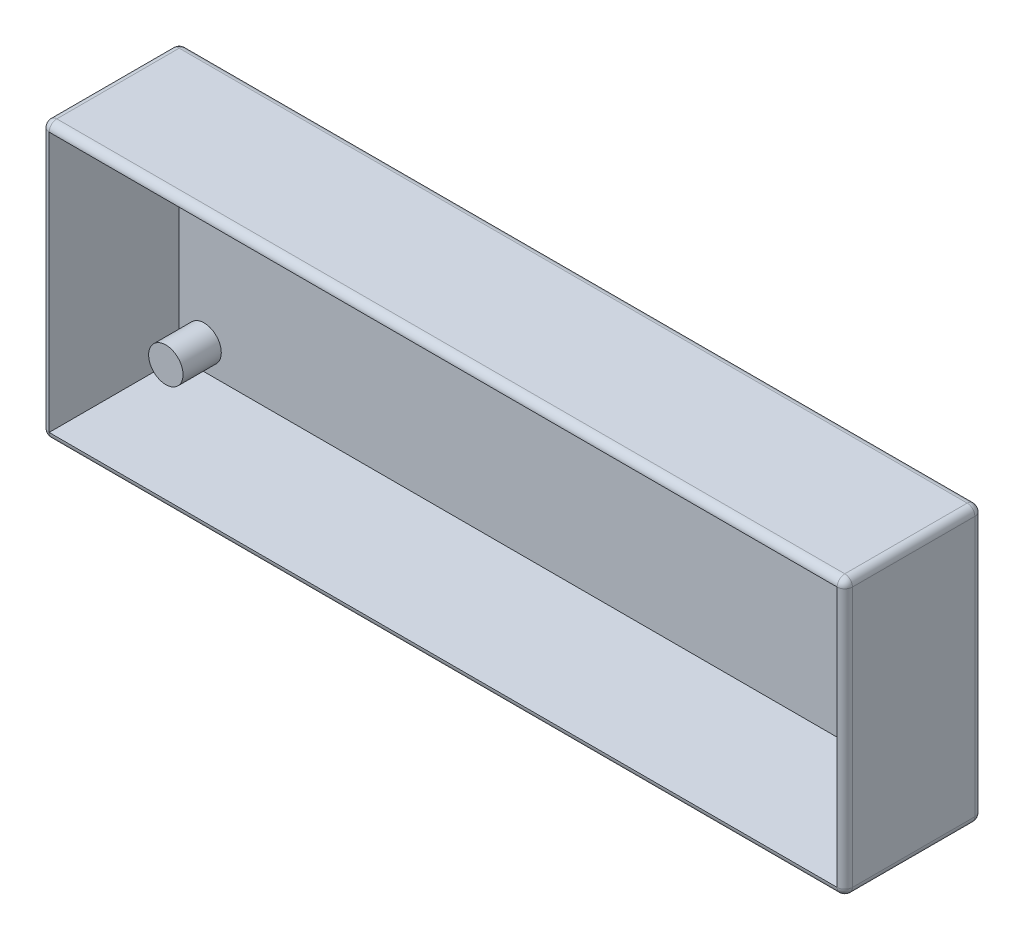
from build123d import *

# Parameters (mm, degrees)
SKETCH2_W           = 105
SKETCH2_H           = 36
BOSS_EXTRUDE1_DEPTH = 9
SHELL1_T            = -1
SKETCH3_R           = 2.25
BOSS_EXTRUDE2_DEPTH = 5
FILLET1_R           = 1
SKETCH5_W           = 0.569871795
SKETCH5_H           = 2.320192308
CUT_EXTRUDE3_DEPTH  = 0.5


with BuildPart() as part:
    # Sketch2 → Boss-Extrude1 (new, symmetric)
    with BuildSketch(Plane.XY):
        Rectangle(SKETCH2_W, SKETCH2_H)
    extrude(amount=BOSS_EXTRUDE1_DEPTH, both=True)

    # Shell1
    shell1_openings = [part.faces().sort_by_distance(p)[0] for p in [
        (0, 0, 9),
    ]]
    offset(amount=SHELL1_T, openings=shell1_openings, kind=Kind.INTERSECTION)

    # Sketch3 → Boss-Extrude2 (add)
    with BuildSketch(Plane.XY.offset(-8)):
        with Locations((-48.25, 13.5)):
            Circle(SKETCH3_R)
        with Locations((48.337693675, 13.587693675)):
            Circle(SKETCH3_R)
        with Locations((48.337693675, -13.629698187)):
            Circle(SKETCH3_R)
        with Locations((-48.25, -13.717391863)):
            Circle(SKETCH3_R)
    extrude(amount=BOSS_EXTRUDE2_DEPTH)

    # Fillet1
    fillet1_edges = [part.edges().sort_by_distance(p)[0] for p in [
        (52.5, 0, 9),
        (0, 18, 9),
        (-52.5, 0, 9),
        (0, 18, -9),
        (52.5, 0, -9),
        (0, -18, -9),
        (-52.5, 0, -9),
        (-52.5, 18, 0),
        (52.5, 18, 0),
        (52.5, -18, 0),
        (-52.5, -18, 0),
        (0, -18, 9),
    ]]
    fillet(fillet1_edges, radius=FILLET1_R - 0.0001)  # a hair under: the kernel refuses the full size

    # Sketch5 → Cut-Extrude3 (cut)
    # profile 1 of 14: a face of its own
    with BuildSketch(Plane.XZ.offset(18)):
        with BuildLine():
            Line((-11.723873197, -3.329997997), (-12.155093149, -3.742773438))
            add(Edge.make_bspline(
                [(-12.155093149, -3.742773438), (-12.189233585, -3.708592095), (-12.256222757, -3.641522658), (-12.365775168, -3.554227177), (-12.479238217, -3.480008761), (-12.596985357, -3.418981187), (-12.719180611, -3.371642895), (-12.845582834, -3.3377803), (-12.976397668, -3.317695822), (-13.064953471, -3.314884063), (-13.109755609, -3.313461538)],
                knots=[0, 0, 0, 0, 1.075575784, 2.110457258, 3.113929901, 4.09197124, 5.059417775, 6.02750972, 7.002078037, 8, 8, 8, 8], degree=3))
            add(Edge.make_bspline(
                [(-13.109755609, -3.313461538), (-13.148597693, -3.314458295), (-13.224867528, -3.316415514), (-13.336938707, -3.331278498), (-13.444029583, -3.356106446), (-13.546646098, -3.390501422), (-13.644161742, -3.435260156), (-13.737141541, -3.48969185), (-13.825013294, -3.554212912), (-13.907085075, -3.627600245), (-13.981811696, -3.707724396), (-14.047051983, -3.79348557), (-14.10262269, -3.883285251), (-14.148368717, -3.977582868), (-14.183176468, -4.076233693), (-14.208024647, -4.17916611), (-14.223797062, -4.286080983), (-14.225659313, -4.359019417), (-14.226602564, -4.395963542)],
                knots=[0, 0, 0, 0, 1.075001177, 2.110859044, 3.123021556, 4.114053297, 5.101481495, 6.087880186, 7.091499647, 8.114004866, 9.131394192, 10.11971144, 11.092043119, 12.050101265, 13.015322563, 13.981809771, 14.977764287, 16, 16, 16, 16], degree=3))
            add(Edge.make_bspline(
                [(-14.226602564, -4.395963542), (-14.225722745, -4.434186352), (-14.223989381, -4.509490522), (-14.207338457, -4.620002628), (-14.181684842, -4.726323238), (-14.14413479, -4.827663477), (-14.097922048, -4.925411564), (-14.039316677, -5.017674028), (-13.97097695, -5.105859816), (-13.893024981, -5.188433563), (-13.808233368, -5.264546685), (-13.716401293, -5.330203823), (-13.62032285, -5.386851761), (-13.518447329, -5.431715097), (-13.412542987, -5.467735441), (-13.30153565, -5.493132875), (-13.18567528, -5.508714112), (-13.106624794, -5.51058764), (-13.06650641, -5.511538462)],
                knots=[0, 0, 0, 0, 1.022067601, 2.013613092, 2.983553406, 3.943623673, 4.90013463, 5.87121881, 6.861774014, 7.881098904, 8.905697761, 9.905387765, 10.89678721, 11.884561068, 12.87834324, 13.885584958, 14.926927371, 16, 16, 16, 16], degree=3))
            add(Edge.make_bspline(
                [(-13.06650641, -5.511538462), (-13.040410888, -5.511303006), (-12.98917957, -5.510840755), (-12.914031958, -5.503337116), (-12.842058595, -5.492609792), (-12.772980749, -5.478408089), (-12.70749592, -5.458310131), (-12.644697426, -5.434808043), (-12.584953211, -5.407070894), (-12.528587202, -5.3741417), (-12.474760509, -5.337232098), (-12.42397696, -5.294999665), (-12.375345753, -5.248396586), (-12.329435136, -5.196853539), (-12.28702216, -5.139909668), (-12.246748022, -5.078611393), (-12.209073852, -5.012350366), (-12.186813179, -4.965560185), (-12.175445713, -4.941666667)],
                knots=[0, 0, 0, 0, 1.109579412, 2.178351274, 3.208885622, 4.204702371, 5.174744997, 6.119429583, 7.05542196, 7.97267548, 8.893247984, 9.828544973, 10.778894627, 11.756245826, 12.760884819, 13.796418446, 14.874735809, 16, 16, 16, 16], degree=3))
            Line((-12.175445713, -4.941666667), (-13.086858974, -4.941666667))
            Line((-13.086858974, -4.941666667), (-13.086858974, -4.371794872))
            Line((-13.086858974, -4.371794872), (-11.503811098, -4.371794872))
            Line((-11.503811098, -4.371794872), (-11.499358974, -4.507266627))
            add(Edge.make_bspline(
                [(-11.499358974, -4.507266627), (-11.499931039, -4.542059211), (-11.501074148, -4.611582288), (-11.511520961, -4.715090307), (-11.528825948, -4.817225506), (-11.552483521, -4.917885304), (-11.582132446, -5.017563474), (-11.619944105, -5.115305513), (-11.664221328, -5.211774275), (-11.713830814, -5.306559844), (-11.769577603, -5.397509174), (-11.829597207, -5.483626184), (-11.893034005, -5.564761824), (-11.961267722, -5.63978567), (-12.033235846, -5.709327956), (-12.109080048, -5.773121145), (-12.189068584, -5.831219214), (-12.272777723, -5.884112958), (-12.36068427, -5.930471204), (-12.452304915, -5.970796728), (-12.547501322, -6.005044344), (-12.646519266, -6.033119939), (-12.749163906, -6.054782494), (-12.85543744, -6.069636537), (-12.965398234, -6.079730026), (-13.039982314, -6.080843408), (-13.077954728, -6.081410256)],
                knots=[0, 0, 0, 0, 1.006889344, 2.011981806, 3.007738725, 4.003571281, 5.003404394, 6.015442001, 7.03424805, 8.074616296, 9.110249922, 10.119753985, 11.111721717, 12.089233633, 13.052717867, 14.006597561, 14.955430184, 15.912305663, 16.870361111, 17.829300583, 18.807640451, 19.796414044, 20.806216501, 21.841577364, 22.90109906, 24, 24, 24, 24], degree=3))
            add(Edge.make_bspline(
                [(-13.077954728, -6.081410256), (-13.118468718, -6.080850484), (-13.198779531, -6.079740847), (-13.317529831, -6.069348343), (-13.432835111, -6.052196185), (-13.544724132, -6.028458186), (-13.653456675, -5.998914349), (-13.758845923, -5.961829845), (-13.860676325, -5.917716656), (-13.959252816, -5.867742914), (-14.053315482, -5.811068338), (-14.142653512, -5.748686723), (-14.226779283, -5.680196797), (-14.306554503, -5.606745095), (-14.380115314, -5.526526169), (-14.450203042, -5.442140301), (-14.513422175, -5.350492557), (-14.572490948, -5.254554182), (-14.624968118, -5.154365379), (-14.670860157, -5.051779192), (-14.709996863, -4.947389596), (-14.740857101, -4.840710518), (-14.765912724, -4.732485814), (-14.783840493, -4.622244838), (-14.793965141, -4.510001392), (-14.79563424, -4.434567982), (-14.796474359, -4.396599559)],
                knots=[0, 0, 0, 0, 1.084149091, 2.14910686, 3.187506334, 4.202448172, 5.208724393, 6.201130722, 7.189831603, 8.176984443, 9.156919086, 10.126598231, 11.090766514, 12.05840148, 13.026036446, 14.001772938, 14.991905635, 16.003017641, 17.015720547, 18.016462227, 19.009322657, 19.99686681, 20.986544154, 21.980959929, 22.983742515, 24, 24, 24, 24], degree=3))
            add(Edge.make_bspline(
                [(-14.796474359, -4.396599559), (-14.79534926, -4.344802517), (-14.793127523, -4.242518714), (-14.77255087, -4.091854024), (-14.740474933, -3.94610097), (-14.694442733, -3.805790374), (-14.635372551, -3.670728957), (-14.564101169, -3.540599655), (-14.479080418, -3.415540786), (-14.413268517, -3.338111977), (-14.379882812, -3.298833133)],
                knots=[0, 0, 0, 0, 1.034044851, 2.041932006, 3.031217818, 4.011390712, 4.986069675, 5.97149666, 6.970960976, 8, 8, 8, 8], degree=3))
            add(Edge.make_bspline(
                [(-14.379882812, -3.298833133), (-14.359153954, -3.276109131), (-14.318007483, -3.23100233), (-14.252234923, -3.168325511), (-14.184794353, -3.109406982), (-14.114751709, -3.055496075), (-14.042475194, -3.005412652), (-13.967756782, -2.960095569), (-13.890988429, -2.918101904), (-13.811571435, -2.881576014), (-13.729921559, -2.848827506), (-13.645677185, -2.821117664), (-13.559469289, -2.79657333), (-13.470534494, -2.777901387), (-13.379771256, -2.762352818), (-13.286535307, -2.751931353), (-13.191080719, -2.744293161), (-13.126520036, -2.743826071), (-13.093855168, -2.743589744)],
                knots=[0, 0, 0, 0, 1.020590567, 2.025856924, 3.013483481, 3.991664875, 4.957826714, 5.930500614, 6.890802512, 7.860442893, 8.829981142, 9.809047939, 10.802672283, 11.803273349, 12.823572789, 13.857849586, 14.916166035, 16, 16, 16, 16], degree=3))
            add(Edge.make_bspline(
                [(-13.093855168, -2.743589744), (-13.059709776, -2.744116324), (-12.991772984, -2.745164026), (-12.890762224, -2.752413442), (-12.791155076, -2.763597581), (-12.693371295, -2.780374429), (-12.597082717, -2.801063774), (-12.502787756, -2.827571945), (-12.409871253, -2.857690003), (-12.349382962, -2.881702344), (-12.319185697, -2.893689904)],
                knots=[0, 0, 0, 0, 1.03180557, 2.052914215, 3.058998889, 4.059601663, 5.049854447, 6.033765722, 7.018406786, 8, 8, 8, 8], degree=3))
            add(Edge.make_bspline(
                [(-12.319185697, -2.893689904), (-12.293778435, -2.904768567), (-12.242100765, -2.927302261), (-12.166916126, -2.968528711), (-12.09154779, -3.014232962), (-12.01680902, -3.066086068), (-11.942813697, -3.12399104), (-11.86878923, -3.187033278), (-11.79549129, -3.255947891), (-11.748055063, -3.304994961), (-11.723873197, -3.329997997)],
                knots=[0, 0, 0, 0, 0.894392155, 1.819168899, 2.76525314, 3.739198753, 4.75366411, 5.797420238, 6.877176959, 8, 8, 8, 8], degree=3))
        make_face()
    # profile 2 of 14: a face of its own
    with BuildSketch(Plane.XZ.offset(18)):
        with BuildLine():
            Line((-11.092307692, -3.679807692), (-10.603846154, -3.679807692))
            Line((-10.603846154, -3.679807692), (-10.603846154, -3.965379607))
            add(Edge.make_bspline(
                [(-10.603846154, -3.965379607), (-10.590028515, -3.940000753), (-10.563021366, -3.890396728), (-10.513406968, -3.823813149), (-10.456407938, -3.767738316), (-10.394072428, -3.720999374), (-10.32621151, -3.684570957), (-10.25464238, -3.658611118), (-10.179977309, -3.64174082), (-10.129043329, -3.639988315), (-10.10330028, -3.639102564)],
                knots=[0, 0, 0, 0, 1.09866127, 2.147379032, 3.14564304, 4.131443017, 5.102343063, 6.064490016, 7.021754664, 8, 8, 8, 8], degree=3))
            add(Edge.make_bspline(
                [(-10.10330028, -3.639102564), (-10.084607615, -3.639977871), (-10.046542673, -3.641760309), (-9.988526344, -3.652121645), (-9.929672942, -3.670856913), (-9.890942332, -3.687725531), (-9.871153846, -3.696344151)],
                knots=[0, 0, 0, 0, 0.931404136, 1.896671404, 2.925354185, 4, 4, 4, 4], degree=3))
            Line((-9.871153846, -3.696344151), (-10.047966747, -4.17908153))
            add(Edge.make_bspline(
                [(-10.047966747, -4.17908153), (-10.063771295, -4.171445537), (-10.093477762, -4.157092808), (-10.136606394, -4.14015511), (-10.175747416, -4.129820554), (-10.200562106, -4.128278548), (-10.212059295, -4.127564103)],
                knots=[0, 0, 0, 0, 1.214386998, 2.282580073, 3.20428172, 4, 4, 4, 4], degree=3))
            add(Edge.make_bspline(
                [(-10.212059295, -4.127564103), (-10.222914877, -4.128037532), (-10.244269679, -4.128968849), (-10.275788768, -4.136949917), (-10.305473186, -4.150713023), (-10.334753424, -4.168344927), (-10.361319596, -4.192854593), (-10.387869359, -4.221228882), (-10.411266432, -4.256260717), (-10.435957128, -4.295252928), (-10.456980374, -4.342979359), (-10.47500716, -4.399954883), (-10.49106917, -4.466838745), (-10.502122027, -4.543986066), (-10.512805056, -4.630650313), (-10.519163858, -4.727467589), (-10.523903153, -4.834131751), (-10.524192929, -4.908587185), (-10.52434395, -4.947390825)],
                knots=[0, 0, 0, 0, 0.544232178, 1.070598461, 1.618251235, 2.182094276, 2.777567932, 3.425210017, 4.127676488, 4.886675562, 5.738955394, 6.734782583, 7.883056018, 9.186093582, 10.642914445, 12.264202625, 14.053029461, 16, 16, 16, 16], degree=3))
            Line((-10.52434395, -4.947390825), (-10.522435897, -5.060601963))
            Line((-10.522435897, -5.060601963), (-10.522435897, -6))
            Line((-10.522435897, -6), (-11.092307692, -6))
            Line((-11.092307692, -6), (-11.092307692, -3.679807692))
        make_face()
    # profile 3 of 14: a face of its own
    with BuildSketch(Plane.XZ.offset(18)):
        with BuildLine():
            add(Edge.make_bspline(
                [(-9.343259215, -2.702884615), (-9.318697744, -2.704089694), (-9.270468931, -2.706455982), (-9.201374593, -2.729522028), (-9.137959993, -2.765723497), (-9.081899729, -2.815392775), (-9.035274043, -2.874706978), (-8.999650287, -2.941113172), (-8.979805777, -3.014689096), (-8.977049668, -3.065514575), (-8.975641026, -3.091491386)],
                knots=[0, 0, 0, 0, 0.989868614, 1.943702388, 2.910836514, 3.924849579, 4.949916355, 5.946401046, 6.950409252, 8, 8, 8, 8], degree=3))
            add(Edge.make_bspline(
                [(-8.975641026, -3.091491386), (-8.976999269, -3.117276763), (-8.979645871, -3.167520797), (-9.000107021, -3.240097893), (-9.034300963, -3.306471834), (-9.081304288, -3.364905111), (-9.136756786, -3.413774436), (-9.198785727, -3.450633121), (-9.267217942, -3.472416007), (-9.314698389, -3.474980104), (-9.338807091, -3.476282051)],
                knots=[0, 0, 0, 0, 1.05296456, 2.051751585, 3.055639087, 4.085634717, 5.099016424, 6.062201612, 7.016062274, 8, 8, 8, 8], degree=3))
            add(Edge.make_bspline(
                [(-9.338807091, -3.476282051), (-9.363582963, -3.475081281), (-9.412231365, -3.47272352), (-9.481892419, -3.449603505), (-9.546152807, -3.413687146), (-9.601969883, -3.363003047), (-9.649129537, -3.303267372), (-9.683197233, -3.235315184), (-9.70450742, -3.16123615), (-9.70703692, -3.109657911), (-9.708333333, -3.083223157)],
                knots=[0, 0, 0, 0, 0.989065327, 1.942068821, 2.907541208, 3.917690034, 4.939857478, 5.938239964, 6.943311734, 8, 8, 8, 8], degree=3))
            add(Edge.make_bspline(
                [(-9.708333333, -3.083223157), (-9.706922481, -3.057875632), (-9.704151066, -3.008084077), (-9.684187684, -2.936143962), (-9.64938078, -2.87085416), (-9.603090944, -2.812625759), (-9.547523077, -2.763882999), (-9.484146546, -2.728780992), (-9.415517215, -2.70666764), (-9.367593914, -2.704158644), (-9.343259215, -2.702884615)],
                knots=[0, 0, 0, 0, 1.038616768, 2.040212704, 3.031499824, 4.052181184, 5.074969369, 6.039807101, 7.004644834, 8, 8, 8, 8], degree=3))
        make_face()
    # profile 4 of 14: a face of its own
    with BuildSketch(Plane.XZ.offset(18)):
        with Locations((-9.34198718, -4.839903846)):
            Rectangle(SKETCH5_W, SKETCH5_H)
    # profile 5 of 14: a face of its own
    with BuildSketch(Plane.XZ.offset(18)):
        Polygon((-8.487179487, -2.743589744), (-7.917307692, -2.743589744), (-7.917307692, -3.679807692), (-7.550961538, -3.679807692), (-7.550961538, -4.168269231), (-7.917307692, -4.168269231), (-7.917307692, -6), (-8.487179487, -6), (-8.487179487, -4.168269231), (-8.772115385, -4.168269231), (-8.772115385, -3.679807692), (-8.487179487, -3.679807692), align=None)
    # profile 6 of 14: a face of its own
    with BuildSketch(Plane.XZ.offset(18)):
        Polygon((-6.892683293, -2.825), (-6.301186899, -2.825), (-5.576762821, -5.039613381), (-4.847250601, -2.825), (-4.261478365, -2.825), (-3.724679487, -6), (-4.301547476, -6), (-4.640544872, -3.994636418), (-5.30073117, -6), (-5.856610577, -6), (-6.512980769, -3.994636418), (-6.851342147, -6), (-7.428846154, -6), align=None)
    # profile 7 of 14: a face of its own
    with BuildSketch(Plane.XZ.offset(18)):
        with BuildLine():
            Line((-1.526602564, -3.679807692), (-0.956730769, -3.679807692))
            Line((-0.956730769, -3.679807692), (-0.956730769, -6))
            Line((-0.956730769, -6), (-1.526602564, -6))
            Line((-1.526602564, -6), (-1.526602564, -5.746864984))
            add(Edge.make_bspline(
                [(-1.526602564, -5.746864984), (-1.554839502, -5.771504876), (-1.609641821, -5.819326041), (-1.695992543, -5.881375218), (-1.782595592, -5.93255777), (-1.869867098, -5.973321882), (-1.959148388, -6.003421982), (-2.05108225, -6.025215158), (-2.14699263, -6.038067127), (-2.212191185, -6.039816635), (-2.245302484, -6.040705128)],
                knots=[0, 0, 0, 0, 1.129196829, 2.191548051, 3.199897424, 4.157751732, 5.089409408, 6.034969131, 7.002052659, 8, 8, 8, 8], degree=3))
            add(Edge.make_bspline(
                [(-2.245302484, -6.040705128), (-2.282471389, -6.039868944), (-2.355919252, -6.038216597), (-2.463695837, -6.020822977), (-2.567764844, -5.994198164), (-2.668041799, -5.956520727), (-2.764344257, -5.907698154), (-2.857409223, -5.849004296), (-2.945641281, -5.778378646), (-3.029774932, -5.698876996), (-3.106807198, -5.611424616), (-3.174149533, -5.517235332), (-3.230914115, -5.417645012), (-3.277418301, -5.312983843), (-3.313999848, -5.203328641), (-3.340077256, -5.088331612), (-3.355462958, -4.967951686), (-3.357367274, -4.885953595), (-3.358333333, -4.84435597)],
                knots=[0, 0, 0, 0, 0.980476535, 1.937477201, 2.874147792, 3.812856188, 4.758993464, 5.720109578, 6.712210464, 7.737600662, 8.772720504, 9.783789959, 10.789002326, 11.793715968, 12.802552247, 13.835794126, 14.902098527, 16, 16, 16, 16], degree=3))
            add(Edge.make_bspline(
                [(-3.358333333, -4.84435597), (-3.35731945, -4.801281574), (-3.355330606, -4.716786347), (-3.340782327, -4.592793619), (-3.315186144, -4.474945249), (-3.28028391, -4.363077999), (-3.235388246, -4.257172542), (-3.180708327, -4.157055373), (-3.115500284, -4.062988181), (-3.040359574, -3.976572056), (-2.959226062, -3.897367503), (-2.872427548, -3.828413658), (-2.78132137, -3.769834159), (-2.685810713, -3.722010555), (-2.585909214, -3.685054894), (-2.482011285, -3.658037288), (-2.373655691, -3.641825776), (-2.299842983, -3.64001784), (-2.26247496, -3.639102564)],
                knots=[0, 0, 0, 0, 1.136281865, 2.228943489, 3.287578264, 4.313574083, 5.316051562, 6.317280042, 7.318008486, 8.329309503, 9.333984563, 10.305318864, 11.248632312, 12.186624717, 13.117503092, 14.05354244, 15.014596925, 16, 16, 16, 16], degree=3))
            add(Edge.make_bspline(
                [(-2.26247496, -3.639102564), (-2.227860063, -3.639821696), (-2.159369659, -3.641244598), (-2.058698633, -3.656694596), (-1.961062258, -3.680061621), (-1.866993144, -3.713355425), (-1.775719707, -3.755395626), (-1.688811905, -3.808075131), (-1.604368554, -3.869179844), (-1.552844832, -3.91690392), (-1.526602564, -3.941210938)],
                knots=[0, 0, 0, 0, 1.017011718, 2.012299608, 2.98747302, 3.965332399, 4.941441765, 5.936729654, 6.94912688, 8, 8, 8, 8], degree=3))
            Line((-1.526602564, -3.941210938), (-1.526602564, -3.679807692))
        make_face()
        with BuildLine():
            add(Edge.make_bspline(
                [(-2.142903646, -4.168269231), (-2.165611357, -4.168965982), (-2.210116988, -4.170331568), (-2.275568609, -4.178545666), (-2.338120725, -4.193019271), (-2.397327217, -4.214400915), (-2.454070481, -4.240446873), (-2.507488861, -4.273069007), (-2.558023236, -4.311627676), (-2.605376406, -4.355189375), (-2.648545798, -4.403071647), (-2.685760334, -4.45532158), (-2.717386677, -4.510531335), (-2.744134343, -4.56886691), (-2.763279604, -4.631018593), (-2.778442642, -4.696177282), (-2.786311278, -4.764875288), (-2.787737613, -4.811690853), (-2.788461538, -4.835451723)],
                knots=[0, 0, 0, 0, 1.04836806, 2.054732945, 3.03993516, 4.00574415, 4.955904794, 5.917688631, 6.888591924, 7.88601754, 8.884115178, 9.859153345, 10.841239365, 11.818093293, 12.814750328, 13.83810466, 14.90274714, 16, 16, 16, 16], degree=3))
            add(Edge.make_bspline(
                [(-2.788461538, -4.835451723), (-2.787748671, -4.859428117), (-2.786343975, -4.906673324), (-2.778315414, -4.975950822), (-2.763698004, -5.042061326), (-2.742371755, -5.104470377), (-2.716327457, -5.164020078), (-2.684625689, -5.220435604), (-2.645685621, -5.272719456), (-2.602478386, -5.322108846), (-2.554153773, -5.366211654), (-2.503333454, -5.405370899), (-2.449323266, -5.438135414), (-2.39270918, -5.464615903), (-2.333681761, -5.486195275), (-2.271500985, -5.500486977), (-2.206775992, -5.509623392), (-2.162651254, -5.510895697), (-2.140359575, -5.511538462)],
                knots=[0, 0, 0, 0, 1.099136573, 2.165835871, 3.191374663, 4.196217796, 5.183857741, 6.167377911, 7.154730987, 8.166690795, 9.170734848, 10.148332609, 11.103258353, 12.059567475, 13.009337315, 13.978056681, 14.978520572, 16, 16, 16, 16], degree=3))
            add(Edge.make_bspline(
                [(-2.140359575, -5.511538462), (-2.117228907, -5.510837804), (-2.071880221, -5.509464136), (-2.00536079, -5.501325001), (-1.941968375, -5.486798326), (-1.881966724, -5.465294267), (-1.824439368, -5.439435268), (-1.76990544, -5.407450595), (-1.718956715, -5.368980408), (-1.671335161, -5.32502491), (-1.627699187, -5.276751651), (-1.589970004, -5.223816543), (-1.557106506, -5.167912596), (-1.531260876, -5.107718039), (-1.510735821, -5.044285993), (-1.496009568, -4.977222787), (-1.48799934, -4.906456118), (-1.486606929, -4.858155109), (-1.485897436, -4.83354367)],
                knots=[0, 0, 0, 0, 1.050008698, 2.058587853, 3.036635738, 3.995319155, 4.947022481, 5.895997462, 6.858296291, 7.838991643, 8.833936038, 9.806048392, 10.784806122, 11.771666913, 12.772873988, 13.80724452, 14.882696879, 16, 16, 16, 16], degree=3))
            add(Edge.make_bspline(
                [(-1.485897436, -4.83354367), (-1.486598113, -4.809355536), (-1.487966739, -4.762109084), (-1.496044114, -4.692819989), (-1.510874915, -4.627073598), (-1.53097753, -4.56474906), (-1.557282962, -4.505988879), (-1.590171326, -4.451444566), (-1.627486642, -4.399226364), (-1.671605729, -4.352257232), (-1.718969306, -4.308620006), (-1.770667314, -4.271313185), (-1.825070987, -4.239161131), (-1.88251458, -4.212763056), (-1.943529995, -4.193412265), (-2.007030743, -4.178429657), (-2.074007567, -4.170336498), (-2.119563518, -4.168969565), (-2.142903646, -4.168269231)],
                knots=[0, 0, 0, 0, 1.106611376, 2.161533483, 3.185006901, 4.184773755, 5.152708835, 6.122342771, 7.094156588, 8.082475533, 9.064254463, 10.03606828, 10.992420271, 11.951521816, 12.920622147, 13.915721683, 14.932141191, 16, 16, 16, 16], degree=3))
        make_face(mode=Mode.SUBTRACT)
    # profile 8 of 14: a face of its own
    with BuildSketch(Plane.XZ.offset(18)):
        Polygon((-0.386858974, -2.743589744), (0.183012821, -2.743589744), (0.183012821, -4.642738381), (1.069621394, -3.679807692), (1.773692909, -3.679807692), (0.755428686, -4.785842348), (1.919340946, -6), (1.201913061, -6), (0.183012821, -4.937214543), (0.183012821, -6), (-0.386858974, -6), align=None)
    # profile 9 of 14: a face of its own
    with BuildSketch(Plane.XZ.offset(18)):
        with BuildLine():
            Line((4.495848357, -4.982371795), (2.666025641, -4.982371795))
            add(Edge.make_bspline(
                [(2.666025641, -4.982371795), (2.669756502, -5.003633297), (2.677087938, -5.045413825), (2.693008411, -5.106103669), (2.713325323, -5.163296752), (2.737673862, -5.21706953), (2.765643512, -5.267706277), (2.798267793, -5.314969487), (2.835132893, -5.358817415), (2.87602567, -5.399059492), (2.920264514, -5.435117265), (2.967634884, -5.466706154), (3.018185664, -5.49260711), (3.071337306, -5.514438929), (3.127486977, -5.531731941), (3.186717315, -5.543658602), (3.248871309, -5.550703725), (3.291212508, -5.551722721), (3.312855569, -5.55224359)],
                knots=[0, 0, 0, 0, 1.091296461, 2.144483647, 3.168565212, 4.157007626, 5.126487748, 6.090021542, 7.05641414, 8.019231907, 8.98705074, 9.938580405, 10.892824166, 11.854447369, 12.841318655, 13.858982407, 14.905600794, 16, 16, 16, 16], degree=3))
            add(Edge.make_bspline(
                [(3.312855569, -5.55224359), (3.338980213, -5.551553874), (3.390427331, -5.55019562), (3.465797741, -5.538149928), (3.538691907, -5.51995544), (3.608419993, -5.492898708), (3.675789689, -5.459217833), (3.739691884, -5.417255608), (3.801232673, -5.368238304), (3.838779807, -5.330455786), (3.857922676, -5.311192909)],
                knots=[0, 0, 0, 0, 1.021034703, 2.010718019, 2.977989445, 3.954245119, 4.929443971, 5.918328161, 6.938689359, 8, 8, 8, 8], degree=3))
            Line((3.857922676, -5.311192909), (4.334935897, -5.538251202))
            add(Edge.make_bspline(
                [(4.334935897, -5.538251202), (4.319917415, -5.55900444), (4.290158843, -5.600126219), (4.241578974, -5.657995182), (4.190882787, -5.711989272), (4.138032473, -5.761753362), (4.082961005, -5.807145643), (4.025821578, -5.848719077), (3.965779123, -5.885357432), (3.904034178, -5.91883325), (3.839310361, -5.947531914), (3.771786791, -5.972005122), (3.701749468, -5.994128693), (3.628313972, -6.010985642), (3.5520918, -6.024329466), (3.472900614, -6.033805349), (3.390750851, -6.039658147), (3.334914135, -6.040351989), (3.306495393, -6.040705128)],
                knots=[0, 0, 0, 0, 1.028154879, 2.037251081, 3.030720504, 4.000128189, 4.949298328, 5.894184978, 6.834267904, 7.770992897, 8.712077017, 9.673380525, 10.653304757, 11.658697181, 12.695551717, 13.758623199, 14.859225354, 16, 16, 16, 16], degree=3))
            add(Edge.make_bspline(
                [(3.306495393, -6.040705128), (3.262773624, -6.039813773), (3.177147061, -6.038068105), (3.051902733, -6.021865807), (2.93295536, -5.995000652), (2.819969074, -5.958481599), (2.713432279, -5.910265008), (2.613292249, -5.851292118), (2.518548442, -5.782693556), (2.43209581, -5.703029623), (2.353334911, -5.616320167), (2.284156235, -5.523200133), (2.226268504, -5.424320114), (2.178729935, -5.32033452), (2.141781308, -5.210977189), (2.115143491, -5.096200398), (2.09881419, -4.976058967), (2.097050544, -4.894229242), (2.096153846, -4.852624199)],
                knots=[0, 0, 0, 0, 1.103565453, 2.161269334, 3.182010356, 4.179077853, 5.15417608, 6.128274628, 7.109042802, 8.101804412, 9.090965879, 10.063106201, 11.02526161, 11.978650795, 12.945248442, 13.93468508, 14.949922959, 16, 16, 16, 16], degree=3))
            add(Edge.make_bspline(
                [(2.096153846, -4.852624199), (2.09705937, -4.809961918), (2.098840946, -4.726025797), (2.115002896, -4.603110246), (2.141854952, -4.485832185), (2.178911662, -4.37403011), (2.225729066, -4.267354353), (2.284353319, -4.166738197), (2.353300582, -4.071831353), (2.431777746, -3.983077804), (2.518596618, -3.90296803), (2.610849872, -3.831574211), (2.709574068, -3.772084143), (2.81365255, -3.724016205), (2.922419594, -3.684962218), (3.037132397, -3.658975052), (3.156918167, -3.641526225), (3.238801082, -3.639919297), (3.28041867, -3.639102564)],
                knots=[0, 0, 0, 0, 1.079208495, 2.12329425, 3.130605359, 4.119693003, 5.099659317, 6.073216462, 7.060498243, 8.06384408, 9.066070512, 10.045757761, 11.010926815, 11.975797609, 12.942977511, 13.929384301, 14.947594487, 16, 16, 16, 16], degree=3))
            add(Edge.make_bspline(
                [(3.28041867, -3.639102564), (3.324349895, -3.640007748), (3.410604328, -3.641784984), (3.536720944, -3.657855722), (3.656458114, -3.684884699), (3.770325985, -3.721087978), (3.876870418, -3.770522571), (3.978432517, -3.828044231), (4.072576247, -3.898125603), (4.16030508, -3.977399687), (4.239498282, -4.065351535), (4.308721914, -4.160894181), (4.367622706, -4.263095183), (4.415362382, -4.372368989), (4.45227307, -4.488387547), (4.478935545, -4.611000186), (4.495140292, -4.740673264), (4.49687112, -4.829467852), (4.49775641, -4.874884816)],
                knots=[0, 0, 0, 0, 1.080001299, 2.120471247, 3.119684163, 4.095710327, 5.052285597, 6.002875087, 6.961153713, 7.931888285, 8.906493152, 9.865905668, 10.82813294, 11.801621613, 12.7925306, 13.817193356, 14.883530496, 16, 16, 16, 16], degree=3))
            Line((4.49775641, -4.874884816), (4.495848357, -4.982371795))
        make_face()
        with BuildLine():
            add(Edge.make_bspline(
                [(3.927884615, -4.534615385), (3.917130786, -4.505595155), (3.895749372, -4.44789538), (3.847449648, -4.368283769), (3.783357459, -4.299336881), (3.708813645, -4.238297653), (3.62364267, -4.188754404), (3.53052842, -4.152883482), (3.430647843, -4.131374828), (3.361935388, -4.12885224), (3.326847957, -4.127564103)],
                knots=[0, 0, 0, 0, 0.954238005, 1.897273737, 2.851915805, 3.847685534, 4.862635127, 5.880135777, 6.917509367, 8, 8, 8, 8], degree=3))
            add(Edge.make_bspline(
                [(3.326847957, -4.127564103), (3.28852677, -4.128801516), (3.213616828, -4.131220401), (3.105564337, -4.156946131), (3.003641127, -4.195341016), (2.943552978, -4.234926957), (2.913436498, -4.254767628)],
                knots=[0, 0, 0, 0, 1.044195649, 2.041185066, 3.018232172, 4, 4, 4, 4], degree=3))
            add(Edge.make_bspline(
                [(2.913436498, -4.254767628), (2.894646064, -4.269878718), (2.854585819, -4.302094789), (2.802559463, -4.366362793), (2.751313069, -4.444176918), (2.722176669, -4.503282243), (2.706730769, -4.534615385)],
                knots=[0, 0, 0, 0, 0.82159062, 1.751589201, 2.808063854, 4, 4, 4, 4], degree=3))
            Line((2.706730769, -4.534615385), (3.927884615, -4.534615385))
        make_face(mode=Mode.SUBTRACT)
    # profile 10 of 14: a face of its own
    with BuildSketch(Plane.XZ.offset(18)):
        with BuildLine():
            Line((4.904807692, -3.679807692), (5.393269231, -3.679807692))
            Line((5.393269231, -3.679807692), (5.393269231, -3.965379607))
            add(Edge.make_bspline(
                [(5.393269231, -3.965379607), (5.40708687, -3.940000753), (5.434094019, -3.890396728), (5.483708417, -3.823813149), (5.540707447, -3.767738316), (5.603042957, -3.720999374), (5.670903875, -3.684570957), (5.742473005, -3.658611118), (5.817138075, -3.64174082), (5.868072055, -3.639988315), (5.893815104, -3.639102564)],
                knots=[0, 0, 0, 0, 1.09866127, 2.147379032, 3.14564304, 4.131443017, 5.102343063, 6.064490016, 7.021754664, 8, 8, 8, 8], degree=3))
            add(Edge.make_bspline(
                [(5.893815104, -3.639102564), (5.91250777, -3.639977871), (5.950572712, -3.641760309), (6.00858904, -3.652121645), (6.067442443, -3.670856913), (6.106173053, -3.687725531), (6.125961538, -3.696344151)],
                knots=[0, 0, 0, 0, 0.931404136, 1.896671404, 2.925354185, 4, 4, 4, 4], degree=3))
            Line((6.125961538, -3.696344151), (5.949148638, -4.17908153))
            add(Edge.make_bspline(
                [(5.949148638, -4.17908153), (5.933344089, -4.171445537), (5.903637622, -4.157092808), (5.86050899, -4.14015511), (5.821367968, -4.129820554), (5.796553279, -4.128278548), (5.78505609, -4.127564103)],
                knots=[0, 0, 0, 0, 1.214386998, 2.282580073, 3.20428172, 4, 4, 4, 4], degree=3))
            add(Edge.make_bspline(
                [(5.78505609, -4.127564103), (5.774200507, -4.128037532), (5.752845706, -4.128968849), (5.721326617, -4.136949917), (5.691642198, -4.150713023), (5.66236196, -4.168344927), (5.635795788, -4.192854593), (5.609246026, -4.221228882), (5.585848953, -4.256260717), (5.561158256, -4.295252928), (5.540135011, -4.342979359), (5.522108225, -4.399954883), (5.506046214, -4.466838745), (5.494993358, -4.543986066), (5.484310329, -4.630650313), (5.477951527, -4.727467589), (5.473212232, -4.834131751), (5.472922456, -4.908587185), (5.472771434, -4.947390825)],
                knots=[0, 0, 0, 0, 0.544232178, 1.070598461, 1.618251235, 2.182094276, 2.777567932, 3.425210017, 4.127676488, 4.886675562, 5.738955394, 6.734782583, 7.883056018, 9.186093582, 10.642914445, 12.264202625, 14.053029461, 16, 16, 16, 16], degree=3))
            Line((5.472771434, -4.947390825), (5.474679487, -5.060601963))
            Line((5.474679487, -5.060601963), (5.474679487, -6))
            Line((5.474679487, -6), (4.904807692, -6))
            Line((4.904807692, -6), (4.904807692, -3.679807692))
        make_face()
    # profile 11 of 14: a face of its own
    with BuildSketch(Plane.XZ.offset(18)):
        Polygon((7.448878205, -2.825), (8.057547075, -2.825), (8.873557692, -5.08031851), (9.691476362, -2.825), (10.298237179, -2.825), (9.147045272, -6), (8.598162059, -6), align=None)
    # profile 12 of 14: a face of its own
    with BuildSketch(Plane.XZ.offset(18)):
        Polygon((11.147320713, -2.825), (12.028205128, -2.825), (12.028205128, -6), (11.458333333, -6), (11.458333333, -3.354166667), (10.807051282, -3.354166667), align=None)
    # profile 13 of 14: a face of its own
    with BuildSketch(Plane.XZ.offset(18)):
        with BuildLine():
            add(Edge.make_bspline(
                [(13.473237179, -5.348717949), (13.496242228, -5.34997926), (13.541535196, -5.352462565), (13.606977358, -5.370995207), (13.666039287, -5.40429174), (13.718848543, -5.447721295), (13.76350272, -5.499972849), (13.795777749, -5.559559358), (13.815876219, -5.624749363), (13.818095104, -5.670184828), (13.819230769, -5.693439503)],
                knots=[0, 0, 0, 0, 1.016957001, 2.002212695, 2.9757545, 3.99499976, 5.013036768, 5.994806404, 6.97370641, 8, 8, 8, 8], degree=3))
            add(Edge.make_bspline(
                [(13.819230769, -5.693439503), (13.818102544, -5.716697913), (13.815898195, -5.762140675), (13.79563867, -5.827457708), (13.763550949, -5.887533963), (13.71884496, -5.940345427), (13.666257989, -5.984593453), (13.606841565, -6.017582943), (13.541659862, -6.037166895), (13.496264171, -6.03951437), (13.473237179, -6.040705128)],
                knots=[0, 0, 0, 0, 1.023218912, 1.999186227, 2.986238111, 4.008388923, 5.030539734, 6.0011649, 6.986089706, 8, 8, 8, 8], degree=3))
            add(Edge.make_bspline(
                [(13.473237179, -6.040705128), (13.450204732, -6.039524053), (13.404798284, -6.037195667), (13.339515261, -6.017417869), (13.279660179, -5.984813704), (13.227059995, -5.940291754), (13.182154279, -5.887720973), (13.150978843, -5.827268157), (13.130530605, -5.762165301), (13.128356391, -5.71670625), (13.12724359, -5.693439503)],
                knots=[0, 0, 0, 0, 1.013427518, 1.99788335, 2.976245624, 3.997909735, 5.019573847, 6.001765691, 6.977268297, 8, 8, 8, 8], degree=3))
            add(Edge.make_bspline(
                [(13.12724359, -5.693439503), (13.128363733, -5.670176346), (13.130552291, -5.624724309), (13.150840159, -5.559751093), (13.182204244, -5.499784823), (13.22705625, -5.44777508), (13.279880007, -5.404073209), (13.339378705, -5.371158019), (13.404922888, -5.35243358), (13.450226649, -5.349969497), (13.473237179, -5.348717949)],
                knots=[0, 0, 0, 0, 1.025808215, 2.00424526, 2.981110158, 3.998665696, 5.017428914, 5.998734231, 6.983523959, 8, 8, 8, 8], degree=3))
        make_face()
    # profile 14 of 14: a face of its own
    with BuildSketch(Plane.XZ.offset(18)):
        with BuildLine():
            add(Edge.make_bspline(
                [(15.295427684, -2.743589744), (15.323011844, -2.743999238), (15.377249673, -2.744804414), (15.457131785, -2.753525124), (15.534080346, -2.766699686), (15.608396386, -2.785073604), (15.679544972, -2.809390832), (15.748043938, -2.838498136), (15.813077948, -2.873922255), (15.875476393, -2.913935616), (15.935215238, -2.959236414), (15.990858701, -3.010881663), (16.04342295, -3.067683003), (16.091770163, -3.130499168), (16.136971003, -3.19875878), (16.178876948, -3.272472662), (16.217167197, -3.352001594), (16.252270893, -3.437489092), (16.283660729, -3.530216577), (16.310100349, -3.631247674), (16.332776747, -3.740605454), (16.351917228, -3.858562126), (16.366384337, -3.985274482), (16.37613546, -4.120658341), (16.382827142, -4.264452703), (16.383373271, -4.363094454), (16.383653846, -4.413772035)],
                knots=[0, 0, 0, 0, 0.879237366, 1.728815576, 2.559023295, 3.367336655, 4.166867292, 4.954216142, 5.737608147, 6.525189134, 7.316157332, 8.124696809, 8.942788509, 9.781158001, 10.649253743, 11.551476218, 12.482711956, 13.461909668, 14.496590415, 15.601789533, 16.789733467, 18.056700938, 19.410929216, 20.8549011, 22.384193279, 24, 24, 24, 24], degree=3))
            add(Edge.make_bspline(
                [(16.383653846, -4.413772035), (16.38335062, -4.46508365), (16.382761456, -4.564781196), (16.376413635, -4.709890774), (16.365482387, -4.846257602), (16.351393406, -4.97386757), (16.332095356, -5.09265329), (16.309494656, -5.202922338), (16.282637695, -5.304634743), (16.250213888, -5.397561326), (16.215322675, -5.483198959), (16.176927685, -5.562572828), (16.135698138, -5.635897923), (16.092579715, -5.70428045), (16.045208505, -5.76570453), (15.995890199, -5.8222589), (15.942477389, -5.871789333), (15.887218962, -5.916848405), (15.828090577, -5.955788486), (15.765702011, -5.989844839), (15.698940983, -6.017468586), (15.629024433, -6.041494246), (15.55476062, -6.058742077), (15.477329585, -6.072427664), (15.395857148, -6.079991159), (15.340387431, -6.080929461), (15.311964143, -6.081410256)],
                knots=[0, 0, 0, 0, 1.643780988, 3.193836972, 4.651895693, 6.025988579, 7.305620092, 8.505800249, 9.631074763, 10.672816429, 11.65661981, 12.592235626, 13.49536222, 14.350718032, 15.179365177, 15.97804903, 16.751647189, 17.51006938, 18.259804725, 19.016521909, 19.783502495, 20.571750527, 21.382245291, 22.22305063, 23.089471752, 24, 24, 24, 24], degree=3))
            add(Edge.make_bspline(
                [(15.311964143, -6.081410256), (15.283541622, -6.080920186), (15.227862321, -6.079960146), (15.146169574, -6.072483902), (15.068328194, -6.058686636), (14.993476834, -6.04136183), (14.92213645, -6.017521745), (14.853964965, -5.989071515), (14.78948656, -5.955227657), (14.728522704, -5.91619685), (14.671281544, -5.871439257), (14.616873555, -5.821433611), (14.565419088, -5.766306664), (14.517700895, -5.705440949), (14.472937489, -5.639648895), (14.431595682, -5.568179189), (14.39370032, -5.491135891), (14.358066028, -5.408411608), (14.327104338, -5.318225383), (14.299549872, -5.219771863), (14.276977978, -5.112230358), (14.258824151, -4.995635416), (14.244330146, -4.870234049), (14.233548272, -4.735965729), (14.227165191, -4.592767917), (14.226582207, -4.494340928), (14.226282051, -4.443664864)],
                knots=[0, 0, 0, 0, 0.917216111, 1.796812873, 2.643793957, 3.46689424, 4.273913431, 5.068098542, 5.848489301, 6.620921603, 7.401012384, 8.190319798, 9.003608147, 9.831726257, 10.68377682, 11.569763213, 12.493818149, 13.453288342, 14.474581811, 15.568529029, 16.750744269, 18.018426408, 19.375425659, 20.823733699, 22.36466933, 24, 24, 24, 24], degree=3))
            add(Edge.make_bspline(
                [(14.226282051, -4.443664864), (14.226825754, -4.373254462), (14.227874837, -4.237396686), (14.241169578, -4.0411217), (14.260682886, -3.859699474), (14.289343314, -3.693433485), (14.324781536, -3.541707931), (14.370162025, -3.405522301), (14.421824411, -3.282992161), (14.465847401, -3.210404568), (14.487049279, -3.175445713)],
                knots=[0, 0, 0, 0, 1.288568992, 2.486310467, 3.599230591, 4.627010532, 5.572937695, 6.447898582, 7.252493626, 8, 8, 8, 8], degree=3))
            add(Edge.make_bspline(
                [(14.487049279, -3.175445713), (14.511701813, -3.141102145), (14.559902375, -3.073953702), (14.644182405, -2.985800348), (14.734730324, -2.910407283), (14.833405935, -2.849480719), (14.938648642, -2.801434027), (15.051362007, -2.767499188), (15.171129799, -2.747727171), (15.253376339, -2.744989481), (15.295427684, -2.743589744)],
                knots=[0, 0, 0, 0, 1.058512271, 2.069600068, 3.047294572, 4.004278952, 4.967380941, 5.939006123, 6.946246673, 8, 8, 8, 8], degree=3))
        make_face()
        with BuildLine():
            add(Edge.make_bspline(
                [(15.309420072, -3.313461538), (15.284483763, -3.31464347), (15.235595359, -3.316960683), (15.164655956, -3.336630553), (15.097764528, -3.367011728), (15.046882006, -3.403570723), (15.008796944, -3.438616903), (14.982186638, -3.470332556), (14.956525192, -3.505724939), (14.93385971, -3.546391129), (14.91245758, -3.590869941), (14.891541246, -3.639363281), (14.874395346, -3.693062253), (14.857549953, -3.751052354), (14.842791817, -3.814936858), (14.830427734, -3.88523795), (14.819381513, -3.962412804), (14.811676642, -4.04651197), (14.80449339, -4.137447459), (14.799344095, -4.23542184), (14.797191304, -4.340408683), (14.796506998, -4.412711563), (14.796153846, -4.45002504)],
                knots=[0, 0, 0, 0, 1.076674018, 2.110852608, 3.161083442, 4.239746716, 4.804137807, 5.395870207, 6.026861976, 6.692161227, 7.405688833, 8.16177676, 8.973626916, 9.841385931, 10.773283133, 11.807421078, 12.927755683, 14.143907515, 15.458935494, 16.872852025, 18.386167141, 20, 20, 20, 20], degree=3))
            add(Edge.make_bspline(
                [(14.796153846, -4.45002504), (14.796735091, -4.498366453), (14.79784967, -4.591064698), (14.803687315, -4.724368001), (14.815388389, -4.84568474), (14.829942164, -4.955837125), (14.850383535, -5.054110787), (14.873902655, -5.141435486), (14.902946677, -5.216698045), (14.936512641, -5.28098693), (14.973688458, -5.33567735), (15.014044443, -5.382164453), (15.05620662, -5.422420092), (15.101491005, -5.455119251), (15.149789566, -5.480178379), (15.200699097, -5.498203101), (15.254251951, -5.509236783), (15.290924393, -5.5107668), (15.309420072, -5.511538462)],
                knots=[0, 0, 0, 0, 1.771748488, 3.397459088, 4.888034009, 6.237357457, 7.467047327, 8.564189669, 9.548206622, 10.417051504, 11.216568818, 11.965764335, 12.669334354, 13.348544111, 14.005342236, 14.656555988, 15.322436492, 16, 16, 16, 16], degree=3))
            add(Edge.make_bspline(
                [(15.309420072, -5.511538462), (15.327281038, -5.511010434), (15.362250587, -5.50997662), (15.413244022, -5.499364668), (15.461467038, -5.482111937), (15.506774034, -5.457706739), (15.549327067, -5.426671795), (15.588918164, -5.388870725), (15.625248737, -5.34392674), (15.646415093, -5.310571656), (15.657321715, -5.293384415)],
                knots=[0, 0, 0, 0, 0.992283464, 1.942767638, 2.88273346, 3.832339453, 4.79467288, 5.803907806, 6.868395428, 8, 8, 8, 8], degree=3))
            add(Edge.make_bspline(
                [(15.657321715, -5.293384415), (15.670162425, -5.2698986), (15.697088352, -5.22065075), (15.728247081, -5.137546839), (15.754474762, -5.043819364), (15.777048544, -4.939176634), (15.792487634, -4.823205926), (15.80578376, -4.69664262), (15.812196811, -4.558849395), (15.813239929, -4.463385752), (15.813782051, -4.413772035)],
                knots=[0, 0, 0, 0, 0.710965849, 1.490837728, 2.352621235, 3.297892224, 4.334225155, 5.461620853, 6.680770821, 8, 8, 8, 8], degree=3))
            add(Edge.make_bspline(
                [(15.813782051, -4.413772035), (15.813572641, -4.363727648), (15.813169563, -4.267400744), (15.805774237, -4.129112143), (15.795475682, -4.002808457), (15.780411869, -3.88877167), (15.761029535, -3.786724952), (15.737140735, -3.696674974), (15.708977617, -3.618444263), (15.675579516, -3.552110828), (15.638589043, -3.495736507), (15.599322527, -3.447371712), (15.557613933, -3.406079071), (15.513533012, -3.371703192), (15.466059494, -3.345437441), (15.416100186, -3.326891649), (15.363552668, -3.315672066), (15.327707822, -3.314208327), (15.309420072, -3.313461538)],
                knots=[0, 0, 0, 0, 1.793836731, 3.452829483, 4.963243077, 6.335886805, 7.574563692, 8.684454726, 9.672768357, 10.54971625, 11.340229787, 12.085688095, 12.778991901, 13.440269426, 14.083255152, 14.715733572, 15.344777694, 16, 16, 16, 16], degree=3))
        make_face(mode=Mode.SUBTRACT)
    extrude(amount=-CUT_EXTRUDE3_DEPTH, mode=Mode.SUBTRACT)


solid = part.part
